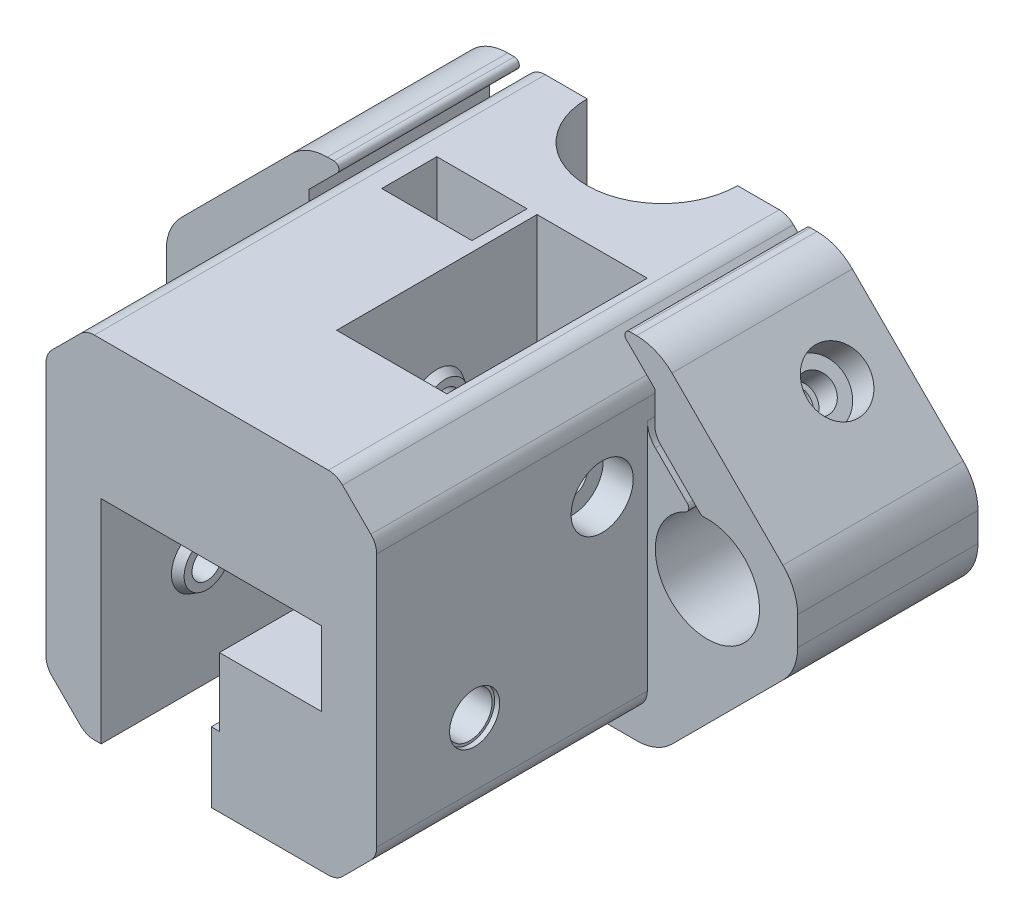
from build123d import *

# Parameters (mm, degrees)
BOSS_EXTRUDE1_DEPTH     = 18
SKETCH2_R               = 7.5
SKETCH2_W               = 9
SKETCH2_H               = 5.5
CUT_EXTRUDE1_DEPTH      = 51.410812332
FILLET1_R               = 5
FILLET2_R               = 0.5
FILLET3_R               = 2
FILLET4_R               = 2.75
CUT_EXTRUDE2_DEPTH      = 15
SKETCH7_R               = 1.6
CUT_EXTRUDE3_DEPTH      = 10
SKETCH8_R               = 2.35
CUT_EXTRUDE4_DEPTH      = 5
SKETCH9_R               = 2.5
CUT_EXTRUDE5_DEPTH      = 0.5
MIRROR3_COPY_1_SKETCH_R = 1.6
MIRROR3_COPY_1_DEPTH    = 10
MIRROR3_COPY_2_SKETCH_R = 2.35
MIRROR3_COPY_2_DEPTH    = 5
MIRROR3_COPY_3_SKETCH_R = 2.5
MIRROR3_COPY_3_DEPTH    = 0.5
BOSS_EXTRUDE2_DEPTH     = 27
SKETCH11_W              = 11
SKETCH11_H              = 20
CUT_EXTRUDE6_DEPTH      = 21.2
SKETCH12_W              = 11
SKETCH12_H              = 3.7
CUT_EXTRUDE7_DEPTH      = 12.5
FILLET5_R               = 10
CUT_EXTRUDE8_REACH      = 67.133
SKETCH13_W              = 11
SKETCH13_H              = 19.8
FILLET6_R               = 10
SKETCH14_W              = 11
SKETCH14_H              = 7.4
CUT_EXTRUDE9_DEPTH      = 12.5
SKETCH15_R              = 2.75
BOSS_EXTRUDE3_DEPTH     = 0.8
BOSS_EXTRUDE3_TAPER     = 30
SKETCH16_W              = 14
SKETCH16_H              = 6.815
CUT_EXTRUDE10_DEPTH     = 0.8
SKETCH19_R              = 2.75
BOSS_EXTRUDE4_DEPTH     = 0.8
BOSS_EXTRUDE4_TAPER     = 30
FILLET7_R               = 2


with BuildPart() as part:
    # Sketch1 → Boss-Extrude1 (new body)
    with BuildSketch(Plane.XY):
        with BuildLine():
            Line((-17.5, 17.5), (-31.5, 3.5))
            Line((-31.5, 3.5), (-31.5, -3.5))
            Line((-31.5, -3.5), (-17.5, -17.5))
            Line((-17.5, -17.5), (17.5, -17.5))
            Line((17.5, -17.5), (31.5, -3.5))
            Line((31.5, -3.5), (31.5, 3.5))
            Line((31.5, 3.5), (17.5, 17.5))
            Line((17.5, 17.5), (13.560660172, 17.5))
            Line((13.560660172, 17.5), (17.25, 13.810660172))
            Line((17.25, 13.810660172), (17.25, 9.845660172))
            Line((17.25, 9.845660172), (21.927294091, 5.168366081))
            ThreePointArc((21.927294091, 5.168366081), (23.518574248, -5.09926529), (21.043225857, 4.991774143))
            Line((21.043225857, 4.991774143), (16.5, 9.535))
            Line((16.5, 9.535), (16.5, 13.5))
            Line((16.5, 13.5), (12.5, 17.5))
            Line((12.5, 17.5), (-12.5, 17.5))
            Line((-12.5, 17.5), (-16.5, 13.5))
            Line((-16.5, 13.5), (-16.5, 9.535))
            Line((-16.5, 9.535), (-21.043225857, 4.991774143))
            ThreePointArc((-21.043225857, 4.991774143), (-23.518574248, -5.09926529), (-21.927294091, 5.168366081))
            Line((-21.927294091, 5.168366081), (-17.25, 9.845660172))
            Line((-17.25, 9.845660172), (-17.25, 13.810660172))
            Line((-17.25, 13.810660172), (-13.560660172, 17.5))
            Line((-13.560660172, 17.5), (-17.5, 17.5))
        make_face()
    extrude(amount=BOSS_EXTRUDE1_DEPTH)

    # Sketch2 → Cut-Extrude1 (cut, through all)
    with BuildSketch(Plane(origin=(0, 17.5, 0), x_dir=(1, 0, 0), z_dir=(0, 1, 0))):
        Circle(SKETCH2_R)
        with Locations((-5.5, -15.25)):
            Rectangle(SKETCH2_W, SKETCH2_H)
    extrude(amount=-CUT_EXTRUDE1_DEPTH, mode=Mode.SUBTRACT)

    # Fillet1
    fillet1_edges = [part.edges().sort_by_distance(p)[0] for p in [
        (17.5, 17.5, 9),
        (31.5, 3.5, 9),
        (31.5, -3.5, 9),
        (17.5, -17.5, 9),
        (-17.5, -17.5, 9),
        (-31.5, -3.5, 9),
        (-31.5, 3.5, 9),
        (-17.5, 17.5, 9),
    ]]
    fillet(fillet1_edges, radius=FILLET1_R)

    # Fillet2
    fillet2_edges = [part.edges().sort_by_distance(p)[0] for p in [
        (-13.560660172, 17.5, 9),
        (-21.927294091, 5.168366081, 9),
        (-21.043225857, 4.991774143, 9),
        (21.043225857, 4.991774143, 9),
        (21.927294091, 5.168366081, 9),
        (13.560660172, 17.5, 9),
    ]]
    fillet(fillet2_edges, radius=FILLET2_R)

    # Fillet3
    fillet3_edges = [part.edges().sort_by_distance(p)[0] for p in [
        (-17.25, 9.845660172, 9),
        (17.25, 9.845660172, 9),
    ]]
    fillet(fillet3_edges, radius=FILLET3_R)

    # Fillet4
    fillet4_edges = [part.edges().sort_by_distance(p)[0] for p in [
        (-16.5, 9.535, 9),
        (16.5, 9.535, 9),
    ]]
    fillet(fillet4_edges, radius=FILLET4_R)

    # Sketch4 → Cut-Revolve1 (revolve, cut)
    with BuildSketch(Plane(origin=(0, 0, 6), x_dir=(-1, 0, 0), z_dir=(0, 0, -1))):
        Polygon((23.439696962, 11.560303038), (25.561017306, 9.438982694), (23.439696962, 7.317662351), (22.555813485, 8.201545827), (14.070532111, -0.283735547), (12.833095244, 0.95370132), align=None)
    cut_revolve1 = revolve(axis=Axis((-23.439696962, 11.560303038, 6), (0.7071067811865471, -0.707106781186548, 0)), mode=Mode.SUBTRACT)

    # Sketch6 → Cut-Extrude2 (cut)
    with BuildSketch(Plane(origin=(-6.893398282, 6.893398282, 0), x_dir=(0, 0, 1), z_dir=(-0.7071067811865471, 0.707106781186548, 0))):
        Polygon((3.425, -9.886676943), (6, -11.373353886), (8.575, -9.886676943), (8.575, -6.913323057), (6, -5.426646114), (3.425, -6.913323057), align=None)
    cut_extrude2 = extrude(amount=-CUT_EXTRUDE2_DEPTH, mode=Mode.SUBTRACT)

    # Mirror1: Cut-Revolve1, Cut-Extrude2 across plane
    add(cut_revolve1.mirror(Plane(origin=(0, 0, 0), x_dir=(0, 0, 1), z_dir=(1, 0, 0))), mode=Mode.SUBTRACT)
    add(cut_extrude2.mirror(Plane(origin=(0, 0, 0), x_dir=(0, 0, 1), z_dir=(1, 0, 0))), mode=Mode.SUBTRACT)

    # Sketch7 → Cut-Extrude3 (cut)
    with BuildSketch(Plane(origin=(0, 0, 0), x_dir=(-1, 0, 0), z_dir=(0, 0, -1))):
        with Locations((-12.5, 12.5)):
            Circle(SKETCH7_R)
    cut_extrude3 = extrude(amount=-CUT_EXTRUDE3_DEPTH, mode=Mode.SUBTRACT)

    # Sketch8 → Cut-Extrude4 (cut)
    with BuildSketch(Plane(origin=(0, 0, 0), x_dir=(-1, 0, 0), z_dir=(0, 0, -1))):
        with Locations((-12.5, 12.5)):
            Circle(SKETCH8_R)
    cut_extrude4 = extrude(amount=-CUT_EXTRUDE4_DEPTH, mode=Mode.SUBTRACT)

    # Sketch9 → Cut-Extrude5 (cut)
    with BuildSketch(Plane(origin=(0, 0, 0), x_dir=(-1, 0, 0), z_dir=(0, 0, -1))):
        with Locations((-12.5, 12.5)):
            Circle(SKETCH9_R)
    cut_extrude5 = extrude(amount=-CUT_EXTRUDE5_DEPTH, mode=Mode.SUBTRACT)

    # Mirror2: Cut-Extrude3, Cut-Extrude4, Cut-Extrude5 across plane
    add(cut_extrude3.mirror(Plane.ZX), mode=Mode.SUBTRACT)
    add(cut_extrude4.mirror(Plane.ZX), mode=Mode.SUBTRACT)
    add(cut_extrude5.mirror(Plane.ZX), mode=Mode.SUBTRACT)

    # Mirror3: Cut-Extrude3, Cut-Extrude4, Cut-Extrude5 across plane
    add(cut_extrude3.mirror(Plane(origin=(0, 0, 0), x_dir=(0, 0, 1), z_dir=(1, 0, 0))), mode=Mode.SUBTRACT)
    add(cut_extrude4.mirror(Plane(origin=(0, 0, 0), x_dir=(0, 0, 1), z_dir=(1, 0, 0))), mode=Mode.SUBTRACT)
    add(cut_extrude5.mirror(Plane(origin=(0, 0, 0), x_dir=(0, 0, 1), z_dir=(1, 0, 0))), mode=Mode.SUBTRACT)

    # Mirror3 copy 1 sketch → Mirror3 copy 1 (cut)
    with BuildSketch(Plane(origin=(0, 0, 0), x_dir=(1, 0, 0), z_dir=(0, 0, -1))):
        with Locations((-12.5, 12.5)):
            Circle(MIRROR3_COPY_1_SKETCH_R)
    extrude(amount=-MIRROR3_COPY_1_DEPTH, mode=Mode.SUBTRACT)

    # Mirror3 copy 2 sketch → Mirror3 copy 2 (cut)
    with BuildSketch(Plane(origin=(0, 0, 0), x_dir=(1, 0, 0), z_dir=(0, 0, -1))):
        with Locations((-12.5, 12.5)):
            Circle(MIRROR3_COPY_2_SKETCH_R)
    extrude(amount=-MIRROR3_COPY_2_DEPTH, mode=Mode.SUBTRACT)

    # Mirror3 copy 3 sketch → Mirror3 copy 3 (cut)
    with BuildSketch(Plane(origin=(0, 0, 0), x_dir=(1, 0, 0), z_dir=(0, 0, -1))):
        with Locations((-12.5, 12.5)):
            Circle(MIRROR3_COPY_3_SKETCH_R)
    extrude(amount=-MIRROR3_COPY_3_DEPTH, mode=Mode.SUBTRACT)

    # Sketch10 → Boss-Extrude2 (add)
    with BuildSketch(Plane.XY.offset(18)):
        Polygon((12.5, 17.5), (-12.5, 17.5), (-16.5, 13.5), (-16.5, -13.5), (-12.5, -17.5), (12.5, -17.5), (16.5, -13.5), (16.5, 13.5), align=None)
    extrude(amount=BOSS_EXTRUDE2_DEPTH)

    # Sketch11 → Cut-Extrude6 (cut)
    with BuildSketch(Plane(origin=(0, 17.5, 0), x_dir=(1, 0, 0), z_dir=(0, 1, 0))):
        with Locations((5.5, -22.5)):
            Rectangle(SKETCH11_W, SKETCH11_H)
    extrude(amount=-CUT_EXTRUDE6_DEPTH, mode=Mode.SUBTRACT)

    # Sketch12 → Cut-Extrude7 (cut)
    with BuildSketch(Plane(origin=(0, 0, 32.5), x_dir=(-1, 0, 0), z_dir=(0, 0, -1))):
        with Locations((-5.5, 1.85)):
            Rectangle(SKETCH12_W, SKETCH12_H)
        Polygon((-11, -3.7), (0, -3.7), (0, -3.591245546), (0, 0), (-11, 0), align=None)
    extrude(amount=-CUT_EXTRUDE7_DEPTH, mode=Mode.SUBTRACT)

    # Fillet5
    fillet5_edges = [part.edges().sort_by_distance(p)[0] for p in [
        (5.5, -3.7, 12.5),
    ]]
    fillet(fillet5_edges, radius=FILLET5_R)

    # Cut-Extrude8: up to this face of the body (flat: up to its plane)
    cut_extrude8_end = Plane(part.part.faces().sort_by_distance((5.5, 3.7, 38.75))[0])
    # Sketch13 → Cut-Extrude8 (cut, up to the picked face)
    with BuildSketch(Plane.XZ.offset(17.5), mode=Mode.PRIVATE) as cut_extrude8_sk1:
        with Locations((-5.5, 35.1)):
            Rectangle(SKETCH13_W, SKETCH13_H)
    cut_extrude8_tool1 = split(extrude(cut_extrude8_sk1.sketch, amount=-CUT_EXTRUDE8_REACH, mode=Mode.PRIVATE), bisect_by=cut_extrude8_end, keep=Keep.BOTH, mode=Mode.PRIVATE)
    add(cut_extrude8_tool1.solids().sort_by(Axis((-5.5, -17.5, 35.1), (0, 1, 0)))[0], mode=Mode.SUBTRACT)

    # Fillet6
    # the kernel refuses this fillet: 10 mm, written as the material it adds along each edge
    with BuildSketch(Plane(origin=(25, 3.7, 25.2), x_dir=(0, 0, 1), z_dir=(-1, 0, 0))) as fillet6_piece_1_section:
        with BuildLine():
            CenterArc((FILLET6_R, -FILLET6_R), FILLET6_R, 90, 90)
            Line((0, -FILLET6_R), (0, 0))
            Line((0, 0), (FILLET6_R, 0))
        make_face()
    fillet6_piece_1 = extrude(amount=36, mode=Mode.PRIVATE)
    fillet6_piece_1 = split(fillet6_piece_1, bisect_by=Plane(origin=(5.5, 3.588944861, 32.5), z_dir=(0, 0, 1)), keep=Keep.TOP, mode=Mode.PRIVATE)
    fillet6_piece_1 = split(fillet6_piece_1, bisect_by=Plane(origin=(11, 3.588944861, 33.172467691), z_dir=(-1, 0, 0)), keep=Keep.TOP, mode=Mode.PRIVATE)
    add(fillet6_piece_1)
    with BuildSketch(Plane(origin=(0, 3.7, 25.2), x_dir=(0, 0, 1), z_dir=(-1, 0, 0))) as fillet6_piece_2:
        with BuildLine():
            CenterArc((FILLET6_R, -FILLET6_R), FILLET6_R, 90, 90)
            Line((0, -FILLET6_R), (0, 0))
            Line((0, 0), (FILLET6_R, 0))
        make_face()
    extrude(amount=11)

    # Sketch14 → Cut-Extrude9 (cut)
    with BuildSketch(Plane.XY.offset(45)):
        with Locations((5.5, 0)):
            Rectangle(SKETCH14_W, SKETCH14_H)
    extrude(amount=-CUT_EXTRUDE9_DEPTH, mode=Mode.SUBTRACT)

    # Sketch15 → Boss-Extrude3 (add)
    with BuildSketch(Plane(origin=(-11, 0, 0), x_dir=(0, 0, -1), z_dir=(1, 0, 0))):
        with Locations((-35.23, -6.365)):
            Circle(SKETCH15_R)
    extrude(amount=BOSS_EXTRUDE3_DEPTH, taper=BOSS_EXTRUDE3_TAPER)

    # Sketch16 → Cut-Extrude10 (cut)
    with BuildSketch(Plane.ZY):
        with Locations((38, -7.1075)):
            Rectangle(SKETCH16_W, SKETCH16_H)
    extrude(amount=-CUT_EXTRUDE10_DEPTH, mode=Mode.SUBTRACT)

    # Sketch17 → Cut-Revolve2 (revolve, cut)
    with BuildSketch(Plane.XY.offset(35.23)):
        Polygon((-16.5, -6.365), (-16.5, -3.265), (-13.5, -3.265), (-13.5, -4.865), (11.5, -4.865), (11.5, -4.115), (16, -4.115), (16, -3.865), (16.5, -3.865), (16.5, -6.365), align=None)
    revolve(axis=Axis((31.947720378, -6.365, 35.23), (-1, 0, 0)), mode=Mode.SUBTRACT)

    # Sketch19 → Boss-Extrude4 (add)
    with BuildSketch(Plane.ZY.offset(-11)):
        with Locations((22.5, 6.365)):
            Circle(SKETCH19_R)
    boss_extrude4 = extrude(amount=BOSS_EXTRUDE4_DEPTH, taper=BOSS_EXTRUDE4_TAPER)

    # Mirror4: Boss-Extrude4 across plane
    add(boss_extrude4.mirror(Plane(origin=(5.5, 0, 0), x_dir=(0, 0, 1), z_dir=(1, 0, 0))))

    # Sketch20 → Cut-Revolve3 (revolve, cut)
    with BuildSketch(Plane.XY.offset(22.5), mode=Mode.PRIVATE) as cut_revolve3_sk:
        Polygon((16.5, 6.365), (16.5, 9.465), (13.5, 9.465), (13.5, 7.865), (-11.5, 7.865), (-11.5, 8.615), (-16, 8.615), (-16, 8.865), (-16.5, 8.865), (-16.5, 6.365), align=None)
    revolve(cut_revolve3_sk.sketch.rotate(Axis((11, 6.365, 22.5), (-1, 0, 0)), 90), axis=Axis((11, 6.365, 22.5), (-1, 0, 0)), mode=Mode.SUBTRACT)

    # Fillet7
    fillet7_edges = [part.edges().sort_by_distance(p)[0] for p in [
        (16.5, -13.5, 31.5),
        (12.5, -17.5, 31.5),
        (-12.5, -17.5, 31.5),
        (-16.5, -13.5, 31.5),
        (-16.5, 13.5, 22.5),
        (-12.5, 17.5, 22.5),
        (12.5, 17.5, 22.5),
        (16.5, 13.5, 22.5),
    ]]
    fillet(fillet7_edges, radius=FILLET7_R)


solid = part.part
